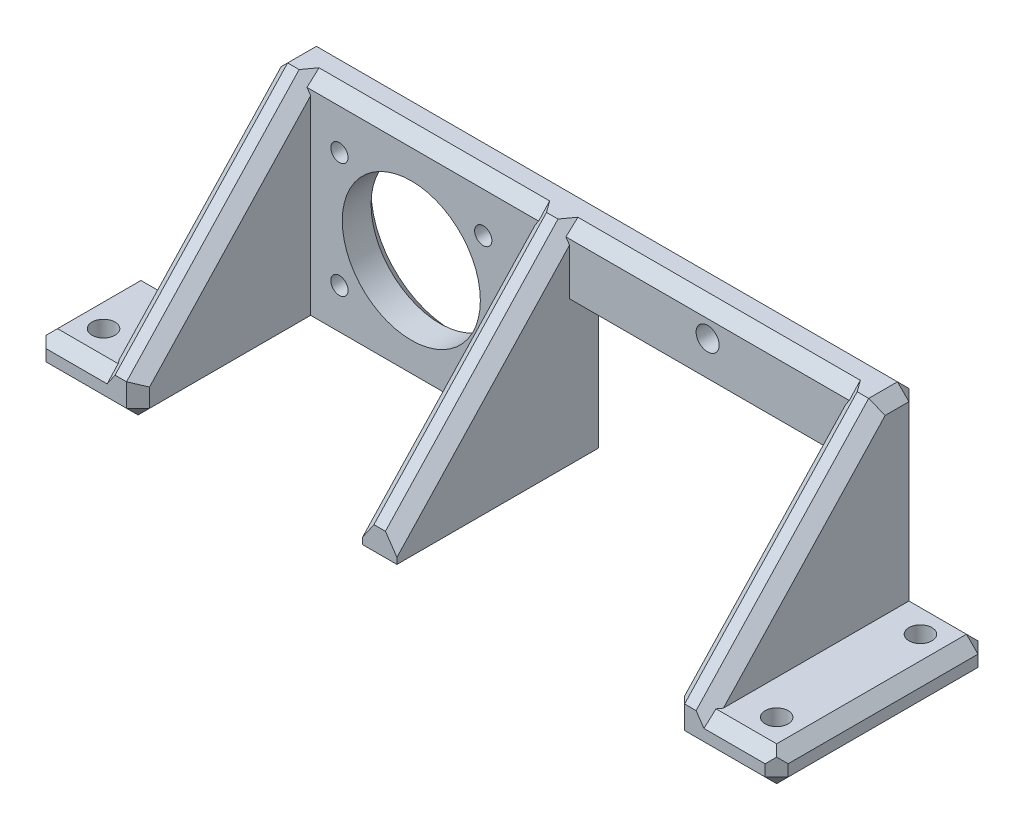
from build123d import *

# Parameters (mm, degrees)
SKETCH1_R           = 12
SKETCH1_R_2         = 1.5
SKETCH1_R_3         = 2
BOSS_EXTRUDE1_DEPTH = 7
BOSS_EXTRUDE2_DEPTH = 6
BOSS_EXTRUDE3_START = -99
BOSS_EXTRUDE3_DEPTH = 6
BOSS_EXTRUDE4_START = -54
BOSS_EXTRUDE4_DEPTH = 6
SKETCH3_W           = 12
SKETCH3_H           = 37
SKETCH3_R           = 2
BOSS_EXTRUDE5_DEPTH = 6
SKETCH4_W           = 12
SKETCH4_H           = 18.5
CUT_EXTRUDE1_DEPTH  = 10
CHAMFER1_SIZE       = 2
CHAMFER2_SIZE       = 2


with BuildPart() as part:
    # Sketch1 → Boss-Extrude1 (new body)
    with BuildSketch(Plane.XY):
        Polygon((0, 0), (45, 0), (45, 27), (93, 27), (93, 0), (99, 0), (99, 38), (0, 38), align=None)
        with Locations((17.5, 19)):
            Circle(SKETCH1_R, mode=Mode.SUBTRACT)
        with Locations((5, 29)):
            Circle(SKETCH1_R_2, mode=Mode.SUBTRACT)
        with Locations((5, 9)):
            Circle(SKETCH1_R_2, mode=Mode.SUBTRACT)
        with Locations((30, 9)):
            Circle(SKETCH1_R_2, mode=Mode.SUBTRACT)
        with Locations((30, 29)):
            Circle(SKETCH1_R_2, mode=Mode.SUBTRACT)
        with Locations((69, 33)):
            Circle(SKETCH1_R_3, mode=Mode.SUBTRACT)
    extrude(amount=BOSS_EXTRUDE1_DEPTH)

    # Sketch2 → Boss-Extrude2 (add)
    with BuildSketch(Plane(origin=(99, 0, 0), x_dir=(0, 0, -1), z_dir=(1, 0, 0))):
        Polygon((-37, 0), (-7, 0), (0, 0), (0, 38), (-7, 38), (-37, 6), align=None)
    extrude(amount=-BOSS_EXTRUDE2_DEPTH)

    # Sketch2<3> → Boss-Extrude3 (add)
    with BuildSketch(Plane(origin=(99, 0, 0), x_dir=(0, 0, -1), z_dir=(1, 0, 0)).offset(BOSS_EXTRUDE3_START)):
        Polygon((-37, 0), (-7, 0), (0, 0), (0, 38), (-7, 38), (-37, 6), align=None)
    extrude(amount=-BOSS_EXTRUDE3_DEPTH)

    # Sketch2<4> → Boss-Extrude4 (add)
    with BuildSketch(Plane(origin=(99, 0, 0), x_dir=(0, 0, -1), z_dir=(1, 0, 0)).offset(BOSS_EXTRUDE4_START)):
        Polygon((-37, 0), (-7, 0), (0, 0), (0, 38), (-7, 38), (-37, 6), align=None)
    extrude(amount=-BOSS_EXTRUDE4_DEPTH)

    # Sketch3 → Boss-Extrude5 (add)
    # profile 1 of 2: a face of its own
    with BuildSketch(Plane(origin=(0, 0, 0), x_dir=(-1, 0, 0), z_dir=(0, -1, 0))):
        with Locations((12, -18.5)):
            Rectangle(SKETCH3_W, SKETCH3_H)
        with Locations(Location((12, -31, 0), (0, 0, 90))):
            Circle(SKETCH3_R, mode=Mode.SUBTRACT)
        with Locations(Location((12, -6, 0), (0, 0, 90))):
            Circle(SKETCH3_R, mode=Mode.SUBTRACT)
    # profile 2 of 2: a face of its own
    with BuildSketch(Plane(origin=(0, 0, 0), x_dir=(-1, 0, 0), z_dir=(0, -1, 0))):
        with Locations((-105, -18.5)):
            Rectangle(SKETCH3_W, SKETCH3_H)
        with Locations(Location((-105, -31, 0), (0, 0, 270))):
            Circle(SKETCH3_R, mode=Mode.SUBTRACT)
        with Locations(Location((-105, -6, 0), (0, 0, 270))):
            Circle(SKETCH3_R, mode=Mode.SUBTRACT)
    extrude(amount=-BOSS_EXTRUDE5_DEPTH)

    # Sketch4 → Cut-Extrude1 (cut)
    with BuildSketch(Plane(origin=(0, 6, 0), x_dir=(1, 0, 0), z_dir=(0, 1, 0))):
        with Locations((-12, -9.25)):
            Rectangle(SKETCH4_W, SKETCH4_H)
    extrude(amount=-CUT_EXTRUDE1_DEPTH, mode=Mode.SUBTRACT)

    # Chamfer1
    chamfer1_edges = [part.edges().sort_by_distance(p)[0] for p in [
        (5.5, 19, 0),
        (69, 38, 7),
        (19.5, 38, 7),
        (111, 0, 18.5),
        (111, 6, 18.5),
        (19.5, 0, 7),
        (0, 0, 22),
        (93, 0, 18.5),
        (93, 3, 37),
        (102, 0, 37),
        (0, 3, 37),
        (39, 0, 22),
        (42, 0, 37),
        (45, 0, 18.5),
        (-9, 0, 37),
        (-18, 3, 37),
        (-18, 0, 27.75),
        (-18, 6, 27.75),
        (19.5, 0, 0),
        (45, 13.5, 0),
        (69, 27, 0),
        (93, 13.5, 0),
        (102, 0, 0),
        (111, 3, 37),
        (111, 3, 0),
        (105, 6, 0),
        (99, 22, 22),
        (99, 38, 3.5),
        (-6, 22, 22),
        (-6, 38, 3.5),
        (-6, 19, 0),
        (99, 22, 0),
        (46.5, 38, 0),
        (-12, 0, 18.5),
        (-12, 6, 18.5),
        (-6, 0, 9.25),
    ]]
    chamfer(chamfer1_edges, length=CHAMFER1_SIZE)

    # Chamfer2
    # the kernel refuses this chamfer: 2 mm, written as the material it takes off along each edge
    with BuildSketch(Plane(origin=(97, 6, 37), x_dir=(0, 0.027495876610588235, -0.9996219169112968), z_dir=(1, 0, 0))) as chamfer2_piece_1_section:
        Polygon((CHAMFER2_SIZE * 0.999621916911, -CHAMFER2_SIZE * 0.0274958766106), (-CHAMFER2_SIZE * 0.0274958766106, -CHAMFER2_SIZE * 0.999621916911), (0, 0), align=None)
    chamfer2_piece_1 = extrude(amount=17.143365976, mode=Mode.PRIVATE)
    chamfer2_piece_1 = split(chamfer2_piece_1, bisect_by=Plane(origin=(100.7856843, 3.388099041, 34.25949849), z_dir=(0.7071067811865475, 0.4836194101643707, 0.5158607041753291)), keep=Keep.TOP, mode=Mode.PRIVATE)
    add(chamfer2_piece_1, mode=Mode.SUBTRACT)
    with BuildSketch(Plane(origin=(-4, 6, 37), x_dir=(-1.1675093231223383e-15, 0.027495876610589956, -0.9996219169112965), z_dir=(-1, 0, 0))) as chamfer2_piece_2_section:
        Polygon((CHAMFER2_SIZE * 0.999621916911, CHAMFER2_SIZE * 0.0274958766106), (-CHAMFER2_SIZE * 0.0274958766106, CHAMFER2_SIZE * 0.999621916911), (0, 0), align=None)
    chamfer2_piece_2 = extrude(amount=17.143365976, mode=Mode.PRIVATE)
    chamfer2_piece_2 = split(chamfer2_piece_2, bisect_by=Plane(origin=(-7.7856843, 3.388099041, 34.25949849), z_dir=(-0.7071067811865475, 0.4836194101643707, 0.5158607041753291)), keep=Keep.TOP, mode=Mode.PRIVATE)
    add(chamfer2_piece_2, mode=Mode.SUBTRACT)
    with BuildSketch(Plane(origin=(0, 41.752276834, 3.482240468), x_dir=(0.027495876610586428, -0.6836825423068311, -0.72926137846062), z_dir=(0, -0.7295372041400852, 0.6839411288813297))) as chamfer2_piece_3_section:
        Polygon((CHAMFER2_SIZE * 0.999621916911, -CHAMFER2_SIZE * 0.0274958766106), (-CHAMFER2_SIZE * 0.0274958766106, -CHAMFER2_SIZE * 0.999621916911), (0, 0), align=None)
    chamfer2_piece_3 = extrude(amount=51.225928058, mode=Mode.PRIVATE)
    chamfer2_piece_3 = split(chamfer2_piece_3, bisect_by=Plane(origin=(-0.581475565, 36.992815088, 6.007184912), z_dir=(0, 0.7071067811865476, 0.7071067811865476)), keep=Keep.TOP, mode=Mode.PRIVATE)
    add(chamfer2_piece_3, mode=Mode.SUBTRACT)
    with BuildSketch(Plane(origin=(0, 41.752276834, 3.482240468), x_dir=(0.027495876610586428, -0.6836825423068311, -0.72926137846062), z_dir=(0, -0.7295372041400852, 0.6839411288813297))) as chamfer2_piece_4_section:
        Polygon((CHAMFER2_SIZE * 0.999621916911, -CHAMFER2_SIZE * 0.0274958766106), (-CHAMFER2_SIZE * 0.0274958766106, -CHAMFER2_SIZE * 0.999621916911), (0, 0), align=None)
    chamfer2_piece_4 = extrude(amount=51.225928058, mode=Mode.PRIVATE)
    chamfer2_piece_4 = split(chamfer2_piece_4, bisect_by=Plane(origin=(-0.512278585, 16.479410692, 7), z_dir=(0, 0, 1)), keep=Keep.TOP, mode=Mode.PRIVATE)
    add(chamfer2_piece_4, mode=Mode.SUBTRACT)
    with BuildSketch(Plane(origin=(93, 41.752276834, 3.482240468), x_dir=(-0.027495876610589116, -0.683682542306831, -0.7292613784606198), z_dir=(0, -0.7295372041400852, 0.6839411288813297))) as chamfer2_piece_5_section:
        Polygon((CHAMFER2_SIZE * 0.999621916911, CHAMFER2_SIZE * 0.0274958766106), (-CHAMFER2_SIZE * 0.0274958766106, CHAMFER2_SIZE * 0.999621916911), (0, 0), align=None)
    chamfer2_piece_5 = extrude(amount=51.225928058, mode=Mode.PRIVATE)
    chamfer2_piece_5 = split(chamfer2_piece_5, bisect_by=Plane(origin=(93.581475565, 36.992815088, 6.007184912), z_dir=(0, 0.7071067811865476, 0.7071067811865476)), keep=Keep.TOP, mode=Mode.PRIVATE)
    add(chamfer2_piece_5, mode=Mode.SUBTRACT)
    with BuildSketch(Plane(origin=(93, 41.752276834, 3.482240468), x_dir=(-0.027495876610589116, -0.683682542306831, -0.7292613784606198), z_dir=(0, -0.7295372041400852, 0.6839411288813297))) as chamfer2_piece_6_section:
        Polygon((CHAMFER2_SIZE * 0.999621916911, CHAMFER2_SIZE * 0.0274958766106), (-CHAMFER2_SIZE * 0.0274958766106, CHAMFER2_SIZE * 0.999621916911), (0, 0), align=None)
    chamfer2_piece_6 = extrude(amount=51.225928058, mode=Mode.PRIVATE)
    chamfer2_piece_6 = split(chamfer2_piece_6, bisect_by=Plane(origin=(93.512278585, 16.479410692, 7), z_dir=(0, 0, 1)), keep=Keep.TOP, mode=Mode.PRIVATE)
    add(chamfer2_piece_6, mode=Mode.SUBTRACT)
    with BuildSketch(Plane(origin=(39, 41.752276834, 3.482240468), x_dir=(0.9996219169112968, 0.01880556088862619, 0.020059264947867937), z_dir=(0, -0.7295372041400852, 0.6839411288813297))) as chamfer2_piece_7_section:
        Polygon((CHAMFER2_SIZE * 0.999621916911, -CHAMFER2_SIZE * 0.0274958766106), (-CHAMFER2_SIZE * 0.0274958766106, -CHAMFER2_SIZE * 0.999621916911), (0, 0), align=None)
    chamfer2_piece_7 = extrude(amount=54.150156351, mode=Mode.PRIVATE)
    chamfer2_piece_7 = split(chamfer2_piece_7, bisect_by=Plane(origin=(39.581475565, 36.992815088, 6.007184912), z_dir=(0, 0.7071067811865476, 0.7071067811865476)), keep=Keep.TOP, mode=Mode.PRIVATE)
    add(chamfer2_piece_7, mode=Mode.SUBTRACT)
    with BuildSketch(Plane(origin=(39, 41.752276834, 3.482240468), x_dir=(0.9996219169112968, 0.01880556088862619, 0.020059264947867937), z_dir=(0, -0.7295372041400852, 0.6839411288813297))) as chamfer2_piece_8_section:
        Polygon((CHAMFER2_SIZE * 0.999621916911, -CHAMFER2_SIZE * 0.0274958766106), (-CHAMFER2_SIZE * 0.0274958766106, -CHAMFER2_SIZE * 0.999621916911), (0, 0), align=None)
    chamfer2_piece_8 = extrude(amount=54.150156351, mode=Mode.PRIVATE)
    chamfer2_piece_8 = split(chamfer2_piece_8, bisect_by=Plane(origin=(39.51114873, 15.48496609, 7), z_dir=(0, 0, 1)), keep=Keep.TOP, mode=Mode.PRIVATE)
    add(chamfer2_piece_8, mode=Mode.SUBTRACT)
    with BuildSketch(Plane(origin=(45, 41.752276834, 3.482240468), x_dir=(0.027495876610585664, -0.6836825423068311, -0.7292613784606199), z_dir=(0, -0.7295372041400852, 0.6839411288813297))) as chamfer2_piece_9_section:
        Polygon((CHAMFER2_SIZE * 0.999621916911, -CHAMFER2_SIZE * 0.0274958766106), (-CHAMFER2_SIZE * 0.0274958766106, -CHAMFER2_SIZE * 0.999621916911), (0, 0), align=None)
    chamfer2_piece_9 = extrude(amount=54.150156351, mode=Mode.PRIVATE)
    chamfer2_piece_9 = split(chamfer2_piece_9, bisect_by=Plane(origin=(44.418524435, 36.992815088, 6.007184912), z_dir=(0, 0.7071067811865476, 0.7071067811865476)), keep=Keep.TOP, mode=Mode.PRIVATE)
    add(chamfer2_piece_9, mode=Mode.SUBTRACT)
    with BuildSketch(Plane(origin=(45, 41.752276834, 3.482240468), x_dir=(0.027495876610585664, -0.6836825423068311, -0.7292613784606199), z_dir=(0, -0.7295372041400852, 0.6839411288813297))) as chamfer2_piece_10_section:
        Polygon((CHAMFER2_SIZE * 0.999621916911, -CHAMFER2_SIZE * 0.0274958766106), (-CHAMFER2_SIZE * 0.0274958766106, -CHAMFER2_SIZE * 0.999621916911), (0, 0), align=None)
    chamfer2_piece_10 = extrude(amount=54.150156351, mode=Mode.PRIVATE)
    chamfer2_piece_10 = split(chamfer2_piece_10, bisect_by=Plane(origin=(44.48885127, 15.48496609, 7), z_dir=(0, 0, 1)), keep=Keep.TOP, mode=Mode.PRIVATE)
    add(chamfer2_piece_10, mode=Mode.SUBTRACT)


solid = part.part
